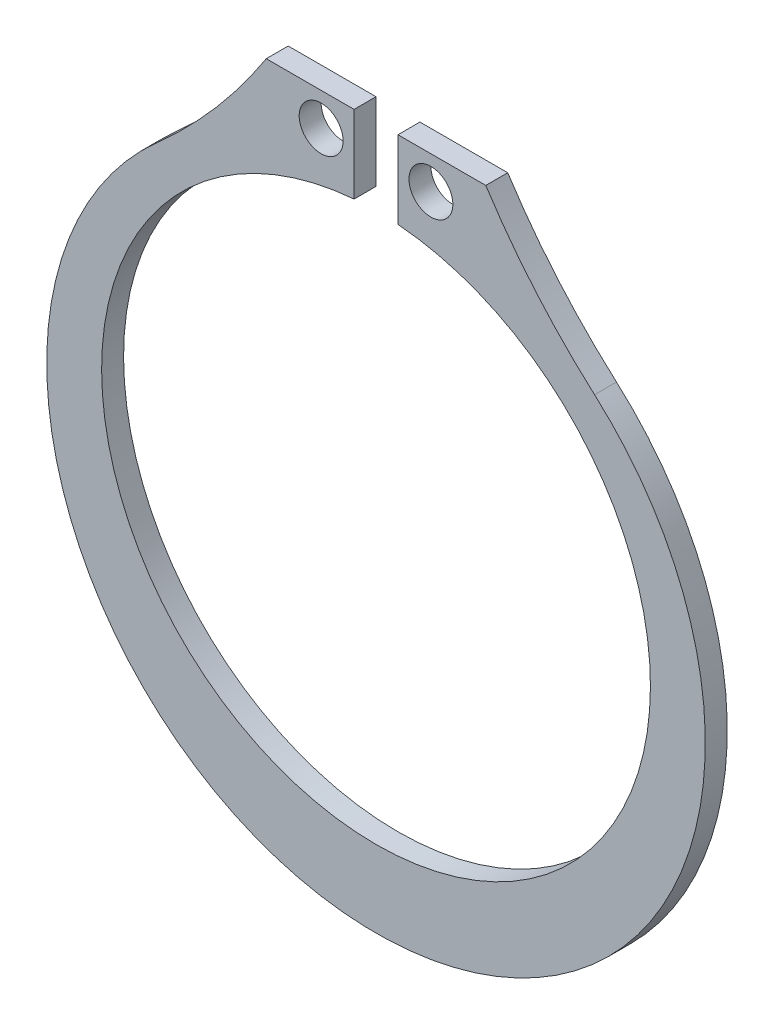
from build123d import *

# Parameters (mm, degrees)
SKETCH1_R           = 1
BOSS_EXTRUDE1_DEPTH = 1


with BuildPart() as part:
    # Sketch1 → Boss-Extrude1 (new body)
    with BuildSketch(Plane.XY):
        with BuildLine():
            Line((-5, 17), (-1, 17))
            Line((-1, 17), (-1, 13.459935794))
            ThreePointArc((-1, 13.459935794), (0, -11.5), (1, 13.459935794))
            Line((1, 13.459935794), (1, 17))
            Line((1, 17), (5, 17))
            ThreePointArc((5, 17), (7.280116529, 13.941078138), (9.954900605, 11.22051487))
            ThreePointArc((9.954900605, 11.22051487), (0, -15), (-9.954900605, 11.22051487))
            ThreePointArc((-9.954900605, 11.22051487), (-7.280116529, 13.941078138), (-5, 17))
        make_face()
        with Locations((-2.5, 15.5)):
            Circle(SKETCH1_R, mode=Mode.SUBTRACT)
        with Locations((2.5, 15.5)):
            Circle(SKETCH1_R, mode=Mode.SUBTRACT)
    extrude(amount=BOSS_EXTRUDE1_DEPTH)


solid = part.part
